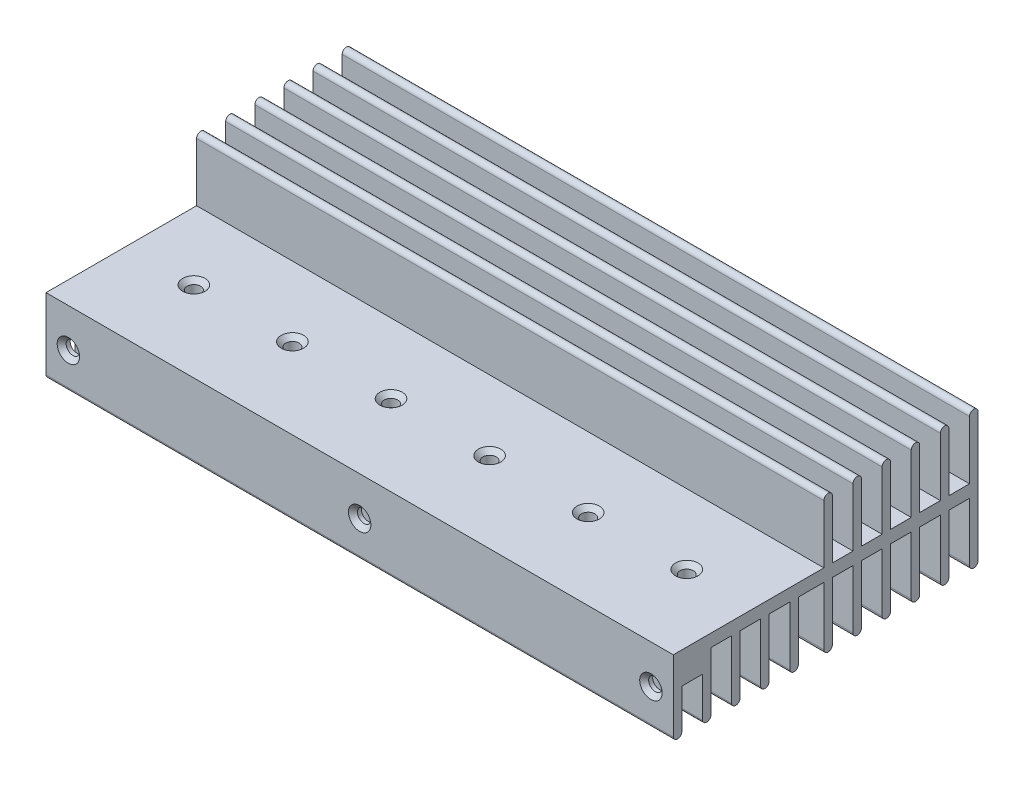
from build123d import *

# Parameters (mm, degrees)
BOSS_EXTRUDE1_DEPTH     = 70
CUT_EXTRUDE1_DEPTH      = 80.602528226
CUT_EXTRUDE1_DEPTH_BACK = 80.602528226
SKETCH2_R               = 1.5
CUT_EXTRUDE2_DEPTH      = 99.790801697
CUT_EXTRUDE2_DEPTH_BACK = 3
SKETCH3_R               = 1.5
CHAMFER1_SIZE           = 1


with BuildPart() as part:
    # Sketch1 → Boss-Extrude1 (new, symmetric)
    with BuildSketch(Plane(origin=(0, 0, 0), x_dir=(0, 0, -1), z_dir=(1, 0, 0))):
        with BuildLine():
            Line((34, 14.4), (34, -14.4))
            ThreePointArc((34, -14.4), (33.05, -15.35), (32.1, -14.4))
            Line((32.1, -14.4), (32.1, -1.4))
            Line((32.1, -1.4), (27.5, -1.4))
            Line((27.5, -1.4), (27.5, -14.4))
            ThreePointArc((27.5, -14.4), (26.55, -15.35), (25.6, -14.4))
            Line((25.6, -14.4), (25.6, -1.4))
            Line((25.6, -1.4), (21, -1.4))
            Line((21, -1.4), (21, -14.4))
            ThreePointArc((21, -14.4), (20.05, -15.35), (19.1, -14.4))
            Line((19.1, -14.4), (19.1, -1.4))
            Line((19.1, -1.4), (14.5, -1.4))
            Line((14.5, -1.4), (14.5, -14.4))
            ThreePointArc((14.5, -14.4), (13.55, -15.35), (12.6, -14.4))
            Line((12.6, -14.4), (12.6, -1.4))
            Line((12.6, -1.4), (8, -1.4))
            Line((8, -1.4), (8, -14.4))
            ThreePointArc((8, -14.4), (7.05, -15.35), (6.1, -14.4))
            Line((6.1, -14.4), (6.1, -1.4))
            Line((6.1, -1.4), (1.5, -1.4))
            Line((1.5, -1.4), (1.5, -14.4))
            ThreePointArc((1.5, -14.4), (0.55, -15.35), (-0.4, -14.4))
            Line((-0.4, -14.4), (-0.4, -1.4))
            Line((-0.4, -1.4), (-6.1, -1.4))
            Line((-6.1, -1.4), (-6.1, -14.492205882))
            ThreePointArc((-6.1, -14.492205882), (-7.05, -15.35), (-8, -14.492205882))
            Line((-8, -14.492205882), (-8, -1.4))
            Line((-8, -1.4), (-12.6, -1.4))
            Line((-12.6, -1.4), (-12.6, -14.492205882))
            ThreePointArc((-12.6, -14.492205882), (-13.55, -15.35), (-14.5, -14.492205882))
            Line((-14.5, -14.492205882), (-14.5, -1.4))
            Line((-14.5, -1.4), (-19.1, -1.4))
            Line((-19.1, -1.4), (-19.1, -14.492205882))
            ThreePointArc((-19.1, -14.492205882), (-20.05, -15.35), (-21, -14.492205882))
            Line((-21, -14.492205882), (-21, -1.4))
            Line((-21, -1.4), (-25.6, -1.4))
            Line((-25.6, -1.4), (-25.6, -14.492205882))
            ThreePointArc((-25.6, -14.492205882), (-26.55, -15.35), (-27.5, -14.492205882))
            Line((-27.5, -14.492205882), (-27.5, -5.6))
            Line((-27.5, -5.6), (-32.1, -5.6))
            Line((-32.1, -5.6), (-32.1, -14.492205882))
            ThreePointArc((-32.1, -14.492205882), (-33.05, -15.35), (-34, -14.492205882))
            Line((-34, -14.492205882), (-34, 1.4))
            Line((-34, 1.4), (-0.4, 1.4))
            Line((-0.4, 1.4), (-0.4, 14.4))
            ThreePointArc((-0.4, 14.4), (0.55, 15.35), (1.5, 14.4))
            Line((1.5, 14.4), (1.5, 1.4))
            Line((1.5, 1.4), (6.1, 1.4))
            Line((6.1, 1.4), (6.1, 14.4))
            ThreePointArc((6.1, 14.4), (7.05, 15.35), (8, 14.4))
            Line((8, 14.4), (8, 1.4))
            Line((8, 1.4), (12.6, 1.4))
            Line((12.6, 1.4), (12.6, 14.4))
            ThreePointArc((12.6, 14.4), (13.55, 15.35), (14.5, 14.4))
            Line((14.5, 14.4), (14.5, 1.4))
            Line((14.5, 1.4), (19.1, 1.4))
            Line((19.1, 1.4), (19.1, 14.4))
            ThreePointArc((19.1, 14.4), (20.05, 15.35), (21, 14.4))
            Line((21, 14.4), (21, 1.4))
            Line((21, 1.4), (25.6, 1.4))
            Line((25.6, 1.4), (25.6, 14.4))
            ThreePointArc((25.6, 14.4), (26.55, 15.35), (27.5, 14.4))
            Line((27.5, 14.4), (27.5, 1.4))
            Line((27.5, 1.4), (32.1, 1.4))
            Line((32.1, 1.4), (32.1, 14.4))
            ThreePointArc((32.1, 14.4), (33.05, 15.35), (34, 14.4))
        make_face()
    extrude(amount=BOSS_EXTRUDE1_DEPTH, both=True)

    # Sketch2 → Cut-Extrude1 (cut, two sides: drawn at the far end of the back side and taken through both)
    with BuildSketch(Plane(origin=(0, 1.4, 0), x_dir=(1, 0, 0), z_dir=(0, 1, 0)).offset(-CUT_EXTRUDE1_DEPTH_BACK)):
        with Locations((55, -16)):
            Circle(SKETCH2_R)
        with Locations((33, -16)):
            Circle(SKETCH2_R)
        with Locations((11, -16)):
            Circle(SKETCH2_R)
        with Locations((-55, -16)):
            Circle(SKETCH2_R)
        with Locations((-33, -16)):
            Circle(SKETCH2_R)
        with Locations((-11, -16)):
            Circle(SKETCH2_R)
    extrude(amount=CUT_EXTRUDE1_DEPTH + CUT_EXTRUDE1_DEPTH_BACK, mode=Mode.SUBTRACT)

    # Sketch3 → Cut-Extrude2 (cut, two sides: drawn at the far end of the back side and taken through both)
    with BuildSketch(Plane.XY.offset(34).offset(-CUT_EXTRUDE2_DEPTH_BACK)):
        with Locations((65, -7.25)):
            Circle(SKETCH3_R)
        with Locations((0, -7.25)):
            Circle(SKETCH3_R)
        with Locations((-65, -7.25)):
            Circle(SKETCH3_R)
    extrude(amount=CUT_EXTRUDE2_DEPTH + CUT_EXTRUDE2_DEPTH_BACK, mode=Mode.SUBTRACT)

    # Chamfer1
    chamfer1_edges = [part.edges().sort_by_distance(p)[0] for p in [
        (53.5, 1.4, 16),
        (31.5, 1.4, 16),
        (9.5, 1.4, 16),
        (-12.5, 1.4, 16),
        (-34.5, 1.4, 16),
        (-56.5, 1.4, 16),
        (-66.5, -7.25, 34),
        (-1.5, -7.25, 34),
        (63.5, -7.25, 34),
    ]]
    chamfer(chamfer1_edges, length=CHAMFER1_SIZE)


solid = part.part
